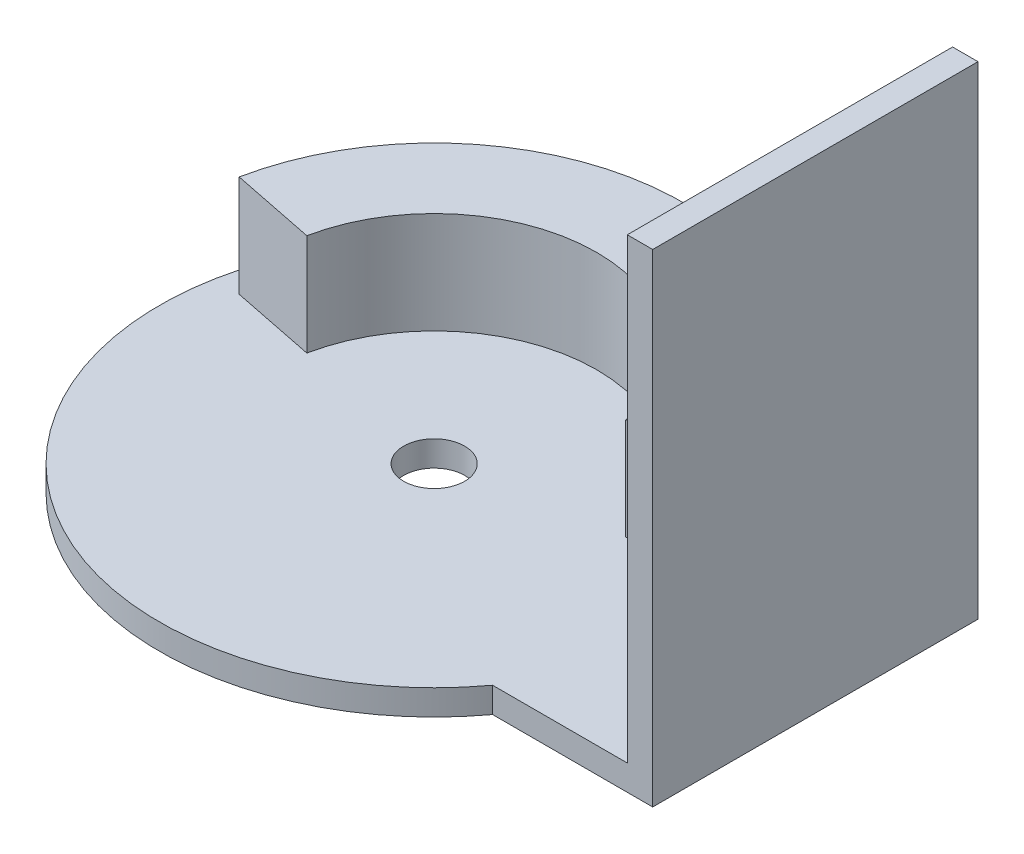
from build123d import *

# Parameters (mm, degrees)
BOSS_EXTRUDE1_DEPTH = 10
SKETCH2_R           = 3
BOSS_EXTRUDE2_DEPTH = 2.5
SKETCH4_W           = 2.5
SKETCH4_H           = 32
BOSS_EXTRUDE3_DEPTH = 45


with BuildPart() as part:
    # Sketch1 → Boss-Extrude1 (new body)
    with BuildSketch(Plane(origin=(0, 0, 0), x_dir=(1, 0, 0), z_dir=(0, 1, 0))):
        with BuildLine():
            Line((-24.017268371, 4.839506173), (-15.684746691, 3.160493827))
            ThreePointArc((-15.684746691, 3.160493827), (0, 16), (15.684746691, 3.160493827))
            Line((15.684746691, 3.160493827), (24.017268371, 4.839506173))
            ThreePointArc((24.017268371, 4.839506173), (0, 24.5), (-24.017268371, 4.839506173))
        make_face()
    extrude(amount=BOSS_EXTRUDE1_DEPTH)

    # Sketch2 → Boss-Extrude2 (add)
    with BuildSketch(Plane.XZ):
        with BuildLine():
            Line((37.5, -16), (37.5, 16))
            Line((37.5, 16), (21.748563171, 16))
            ThreePointArc((21.748563171, 16), (12.186057607, 24.093567606), (0, 27))
            ThreePointArc((0, 27), (-27, 0), (0, -27))
            ThreePointArc((0, -27), (12.186057607, -24.093567606), (21.748563171, -16))
            Line((21.748563171, -16), (37.5, -16))
        make_face()
        Circle(SKETCH2_R, mode=Mode.SUBTRACT)
    extrude(amount=BOSS_EXTRUDE2_DEPTH)

    # Sketch4 → Boss-Extrude3 (add)
    with BuildSketch(Plane(origin=(0, 0, 0), x_dir=(1, 0, 0), z_dir=(0, 1, 0))):
        with Locations((36.25, 0)):
            Rectangle(SKETCH4_W, SKETCH4_H)
    extrude(amount=BOSS_EXTRUDE3_DEPTH)


solid = part.part
